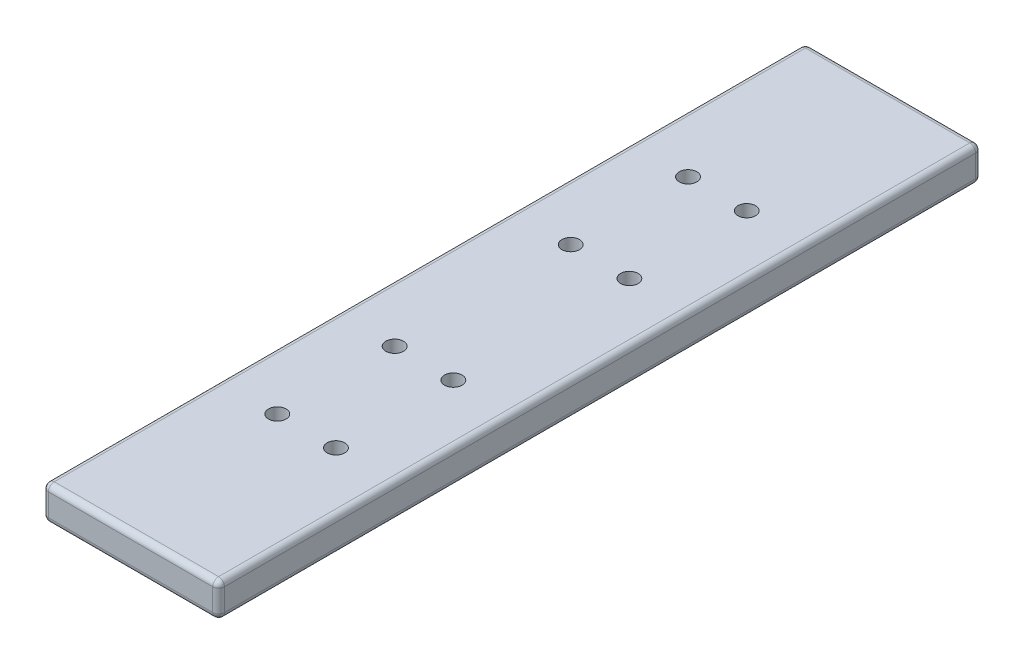
from build123d import *

# Parameters (mm, degrees)
SKETCH2_W           = 30
SKETCH2_H           = 5.8
BOSS_EXTRUDE1_DEPTH = 130
SKETCH3_R           = 1.5
CUT_EXTRUDE3_DEPTH  = 131.990992057
FILLET1_R           = 1


with BuildPart() as part:
    # Sketch2 → Boss-Extrude1 (new body)
    with BuildSketch(Plane.XY):
        Rectangle(SKETCH2_W, SKETCH2_H)
    extrude(amount=BOSS_EXTRUDE1_DEPTH)

    # Sketch3 → Cut-Extrude3 (cut, through all)
    with BuildSketch(Plane(origin=(0, 2.9, 0), x_dir=(1, 0, 0), z_dir=(0, 1, 0))):
        with Locations((-5, -100)):
            Circle(SKETCH3_R)
        with Locations((5, -100)):
            Circle(SKETCH3_R)
        with Locations((5, -80)):
            Circle(SKETCH3_R)
        with Locations((-5, -80)):
            Circle(SKETCH3_R)
        with Locations((-5, -50)):
            Circle(SKETCH3_R)
        with Locations((5, -50)):
            Circle(SKETCH3_R)
        with Locations((5, -30)):
            Circle(SKETCH3_R)
        with Locations((-5, -30)):
            Circle(SKETCH3_R)
    extrude(amount=-CUT_EXTRUDE3_DEPTH, mode=Mode.SUBTRACT)

    # Fillet1
    fillet1_edges = [part.edges().sort_by_distance(p)[0] for p in [
        (15, 0, 0),
        (-15, 0, 0),
        (-15, 0, 130),
        (15, 0, 130),
        (-15, -2.9, 65),
        (0, -2.9, 130),
        (15, -2.9, 65),
        (0, -2.9, 0),
        (15, 2.9, 65),
        (0, 2.9, 130),
        (-15, 2.9, 65),
        (0, 2.9, 0),
    ]]
    fillet(fillet1_edges, radius=FILLET1_R)


solid = part.part
